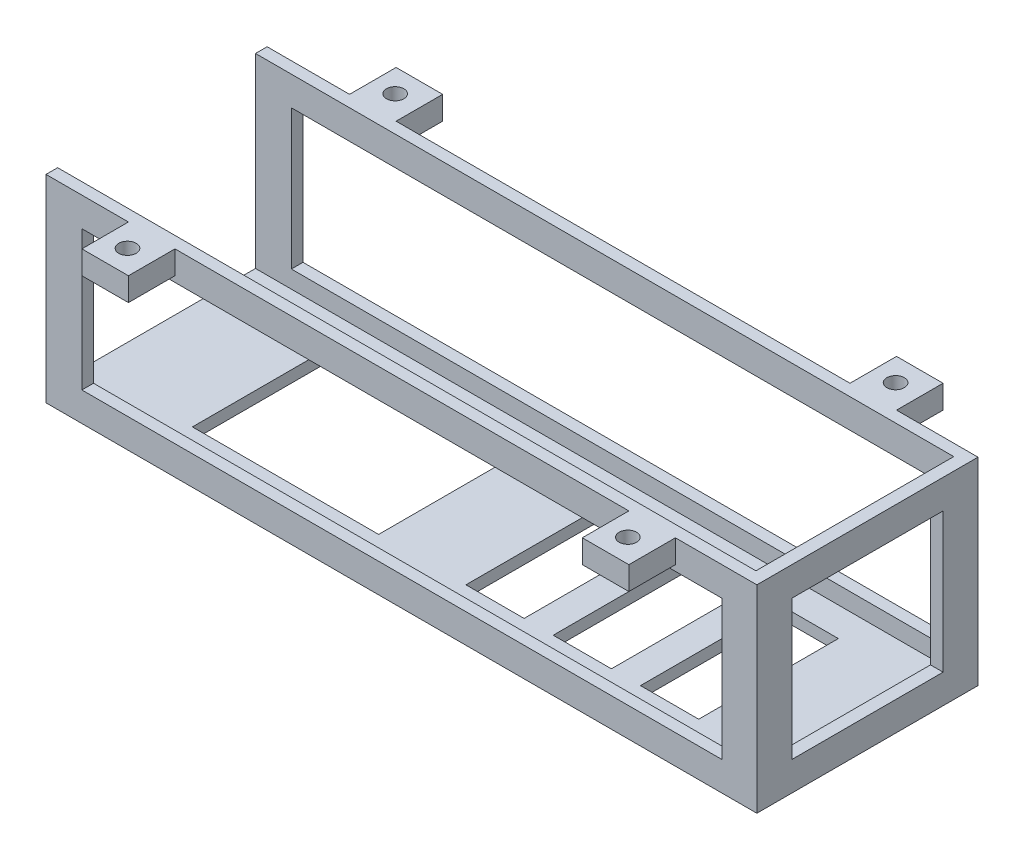
from build123d import *

# Parameters (mm, degrees)
SKETCH1_R              = 1.5
BOSS_EXTRUDE2_DEPTH    = 34
SKETCH3_W              = 120
SKETCH3_H              = 34
CUT_EXTRUDE1_DEPTH     = 32
CUT_EXTRUDE4_START     = -8
CUT_EXTRUDE4_OUTLINE_W = 8
CUT_EXTRUDE4_OUTLINE_H = 30
CUT_EXTRUDE4_DEPTH     = 8
CUT_EXTRUDE5_DEPTH     = 8
SKETCH8_W              = 8
SKETCH8_H              = 30
CUT_EXTRUDE6_DEPTH     = 8
SKETCH9_W              = 8
SKETCH9_H              = 30
CUT_EXTRUDE7_DEPTH     = 8
SKETCH10_W             = 110
SKETCH10_H             = 24
CUT_EXTRUDE8_DEPTH     = 2
SKETCH11_W             = 110
SKETCH11_H             = 24
CUT_EXTRUDE9_DEPTH     = 2
SKETCH12_W             = 26
SKETCH12_H             = 24
CUT_EXTRUDE11_DEPTH    = 2.17
SKETCH13_W             = 10
SKETCH13_H             = 24
SKETCH13_W_2           = 32
CUT_EXTRUDE12_DEPTH    = 2


# Read off the part's stored shape, not the designer's step: Cut-Extrude4
with BuildPart() as part:
    # Sketch1 → Boss-Extrude2 (new body)
    with BuildSketch(Plane(origin=(0, 0, 0), x_dir=(1, 0, 0), z_dir=(0, 1, 0))):
        Polygon((0, 0), (14.166139068, 0), (14.166139068, -8), (22.166139068, -8), (22.166139068, 0), (100.166139068, 0), (100.166139068, -8), (108.166139068, -8), (108.166139068, 0), (122.166139068, 0), (122.166139068, 38), (108.166139068, 38), (108.166139068, 46), (100.166139068, 46), (100.166139068, 38), (22.166139068, 38), (22.166139068, 46), (14.166139068, 46), (14.166139068, 38), (0, 38), align=None)
        with Locations(Location((18, 42, 0), (0, 0, 270))):
            Circle(SKETCH1_R, mode=Mode.SUBTRACT)
        with Locations(Location((18, -4, 0), (0, 0, 270))):
            Circle(SKETCH1_R, mode=Mode.SUBTRACT)
        with Locations(Location((104, -4, 0), (0, 0, 90))):
            Circle(SKETCH1_R, mode=Mode.SUBTRACT)
        with Locations(Location((104, 42, 0), (0, 0, 90))):
            Circle(SKETCH1_R, mode=Mode.SUBTRACT)
    extrude(amount=BOSS_EXTRUDE2_DEPTH)

    # Sketch3 → Cut-Extrude1 (cut)
    with BuildSketch(Plane(origin=(0, 34, 0), x_dir=(1, 0, 0), z_dir=(0, 1, 0))):
        with Locations((60, 19)):
            Rectangle(SKETCH3_W, SKETCH3_H)
    extrude(amount=-CUT_EXTRUDE1_DEPTH, mode=Mode.SUBTRACT)

    # Cut-Extrude4 outline → Cut-Extrude4 (cut)
    with BuildSketch(Plane.ZY.offset(-14.166139068).offset(CUT_EXTRUDE4_START)):
        with Locations((4, 15)):
            Rectangle(CUT_EXTRUDE4_OUTLINE_W, CUT_EXTRUDE4_OUTLINE_H)
    extrude(amount=CUT_EXTRUDE4_DEPTH, mode=Mode.SUBTRACT)

    # Sketch7 → Cut-Extrude5 (cut)
    with BuildSketch(Plane(origin=(108.166139068, 0, 0), x_dir=(0, 0, -1), z_dir=(1, 0, 0))):
        Polygon((-4, 30), (0, 30), (0, 0), (-8, 0), (-8, 30), align=None)
    extrude(amount=-CUT_EXTRUDE5_DEPTH, mode=Mode.SUBTRACT)

    # Sketch8 → Cut-Extrude6 (cut)
    with BuildSketch(Plane(origin=(108.166139068, 0, 0), x_dir=(0, 0, -1), z_dir=(1, 0, 0))):
        with Locations((42, 15)):
            Rectangle(SKETCH8_W, SKETCH8_H)
    extrude(amount=-CUT_EXTRUDE6_DEPTH, mode=Mode.SUBTRACT)

    # Sketch9 → Cut-Extrude7 (cut)
    with BuildSketch(Plane.ZY.offset(-14.166139068)):
        with Locations((-42, 15)):
            Rectangle(SKETCH9_W, SKETCH9_H)
    extrude(amount=-CUT_EXTRUDE7_DEPTH, mode=Mode.SUBTRACT)

    # Sketch10 → Cut-Extrude8 (cut)
    with BuildSketch(Plane(origin=(0, 0, -38), x_dir=(-1, 0, 0), z_dir=(0, 0, -1))):
        with Locations((-61.166139068, 17)):
            Rectangle(SKETCH10_W, SKETCH10_H)
    extrude(amount=-CUT_EXTRUDE8_DEPTH, mode=Mode.SUBTRACT)

    # Sketch11 → Cut-Extrude9 (cut)
    with BuildSketch(Plane.XY):
        with Locations((61.166139068, 17)):
            Rectangle(SKETCH11_W, SKETCH11_H)
    extrude(amount=-CUT_EXTRUDE9_DEPTH, mode=Mode.SUBTRACT)

    # Sketch12 → Cut-Extrude11 (cut)
    with BuildSketch(Plane(origin=(122.166139068, 0, 0), x_dir=(0, 0, -1), z_dir=(1, 0, 0))):
        with Locations((19, 17)):
            Rectangle(SKETCH12_W, SKETCH12_H)
    extrude(amount=-CUT_EXTRUDE11_DEPTH, mode=Mode.SUBTRACT)

    # Sketch13 → Cut-Extrude12 (cut)
    with BuildSketch(Plane.XZ):
        with Locations((100.166139068, -19)):
            Rectangle(SKETCH13_W, SKETCH13_H)
        with Locations((85.166139068, -19)):
            Rectangle(SKETCH13_W, SKETCH13_H)
        with Locations((70.166139068, -19)):
            Rectangle(SKETCH13_W, SKETCH13_H)
        with Locations((34.16188968, -19)):
            Rectangle(SKETCH13_W_2, SKETCH13_H)
    extrude(amount=-CUT_EXTRUDE12_DEPTH, mode=Mode.SUBTRACT)


solid = part.part
